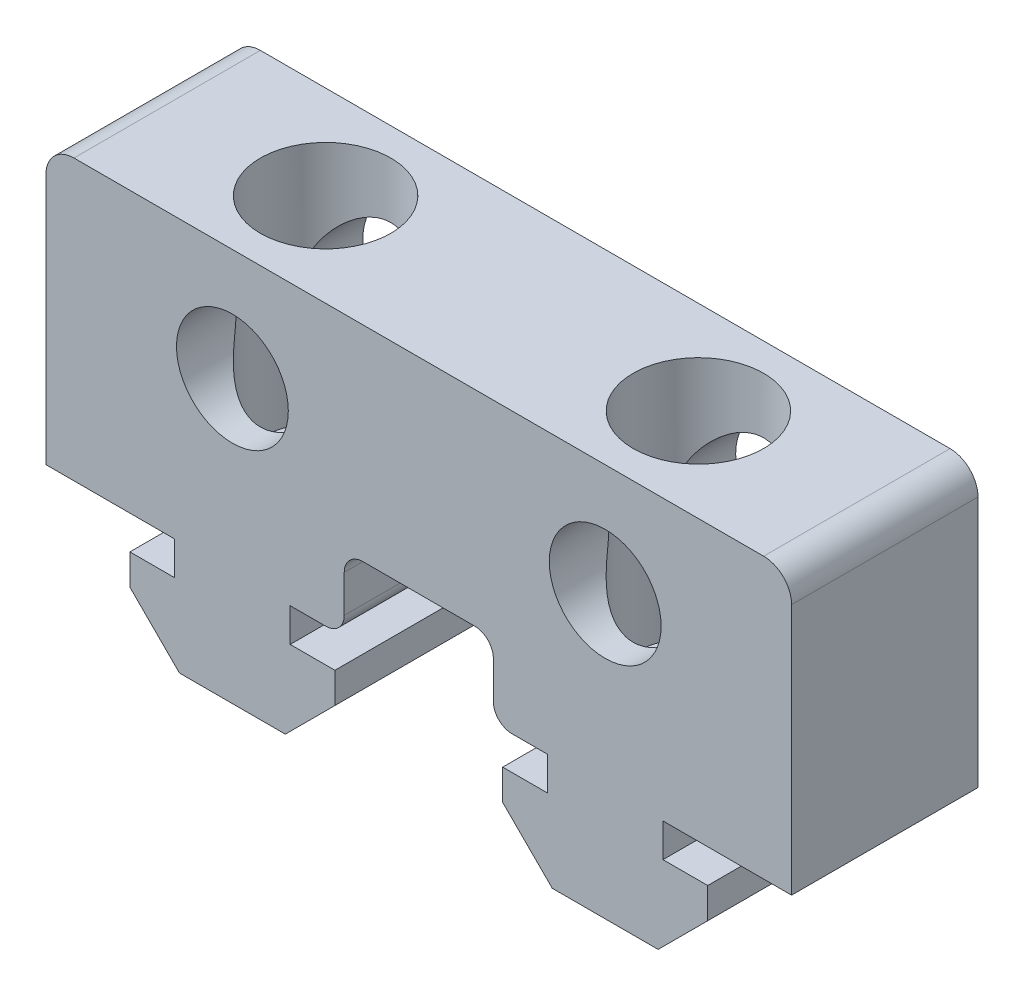
from build123d import *

# Parameters (mm, degrees)
SKETCH_1_W          = 40
SKETCH_1_H          = 15
SKETCH_1_R          = 3
EXTRUDE_1_DEPTH     = 10
EXTRUDE_2_DEPTH     = 10
FILLET_1_R          = 1.5
SKETCH_5_R          = 3.5
CUT_EXTRUDE_1_DEPTH = 13
SKETCH_6_R          = 1.75
CUT_EXTRUDE_2_DEPTH = 13
CUT_EXTRUDE_3_DEPTH = 13
FILLET_2_R          = 1


with BuildPart() as part:
    # 草图1 → 凸台-拉伸1 (new body)
    with BuildSketch(Plane.XY):
        with Locations((0, 7.5)):
            Rectangle(SKETCH_1_W, SKETCH_1_H)
        with Locations((-10, 9)):
            Circle(SKETCH_1_R, mode=Mode.SUBTRACT)
        with Locations((10, 9)):
            Circle(SKETCH_1_R, mode=Mode.SUBTRACT)
    extrude(amount=EXTRUDE_1_DEPTH)

    # 草图4 → 凸台-拉伸2 (add)
    with BuildSketch(Plane.XY.offset(10)):
        Polygon((-6.9, -1.8), (-6.9, 0), (-13.1, 0), (-13.1, -1.8), (-15.5, -1.8), (-15.5, -3.439339828), (-12.839339828, -6.1), (-7.160660172, -6.1), (-4.5, -3.439339828), (-4.5, -1.8), align=None)
        Polygon((13.1, -1.8), (13.1, 0), (6.9, 0), (6.9, -1.8), (4.5, -1.8), (4.5, -3.439339828), (7.160660172, -6.1), (12.839339828, -6.1), (15.5, -3.439339828), (15.5, -1.8), align=None)
    extrude(amount=-EXTRUDE_2_DEPTH)

    # 圆角1
    fillet_1_edges = [part.edges().sort_by_distance(p)[0] for p in [
        (20, 15, 5),
        (-20, 15, 5),
    ]]
    fillet(fillet_1_edges, radius=FILLET_1_R)

    # 草图5 → 切除-拉伸1 (cut)
    with BuildSketch(Plane(origin=(0, 15, 0), x_dir=(1, 0, 0), z_dir=(0, 1, 0))):
        with Locations((-10, -5)):
            Circle(SKETCH_5_R)
        with Locations((10, -5)):
            Circle(SKETCH_5_R)
    extrude(amount=-CUT_EXTRUDE_1_DEPTH, mode=Mode.SUBTRACT)

    # 草图6 → 切除-拉伸2 (cut)
    with BuildSketch(Plane(origin=(0, 2, 0), x_dir=(1, 0, 0), z_dir=(0, 1, 0))):
        with Locations((10, -5)):
            Circle(SKETCH_6_R)
        with Locations((-10, -5)):
            Circle(SKETCH_6_R)
    extrude(amount=-CUT_EXTRUDE_2_DEPTH, mode=Mode.SUBTRACT)

    # 草图7 → 切除-拉伸3 (cut)
    with BuildSketch(Plane.XY.offset(10)):
        Polygon((0, 4), (-4, 4), (-4, 0), (4, 0), (4, 4), align=None)
    extrude(amount=-CUT_EXTRUDE_3_DEPTH, mode=Mode.SUBTRACT)

    # 圆角2
    fillet_2_edges = [part.edges().sort_by_distance(p)[0] for p in [
        (-4, 0, 5),
        (4, 0, 5),
        (4, 4, 5),
        (-4, 4, 5),
    ]]
    fillet(fillet_2_edges, radius=FILLET_2_R)


solid = part.part
